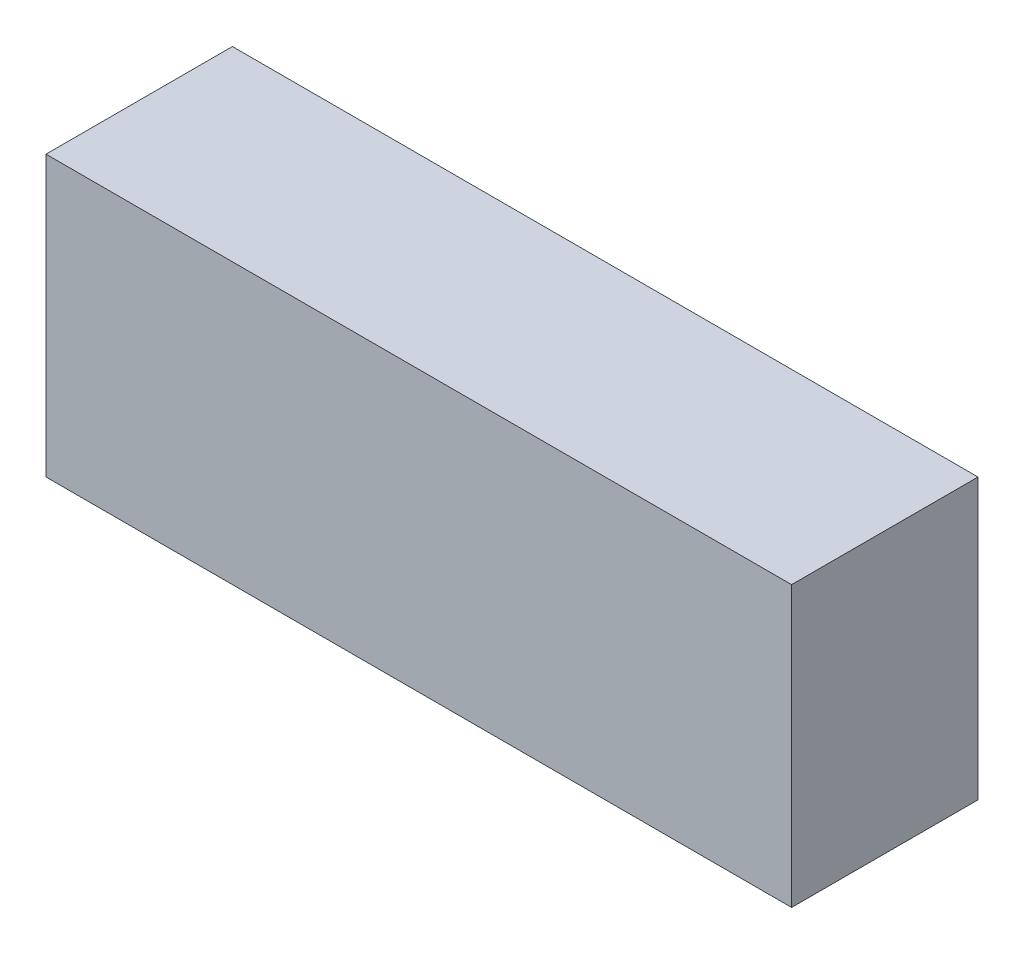
from build123d import *

# Parameters (mm, degrees)
SKETCH1_W           = 80
SKETCH1_H           = 20
BOSS_EXTRUDE1_DEPTH = 30


with BuildPart() as part:
    # Sketch1 → Boss-Extrude1 (new body)
    with BuildSketch(Plane(origin=(0, 0, 0), x_dir=(1, 0, 0), z_dir=(0, 1, 0))):
        Rectangle(SKETCH1_W, SKETCH1_H)
    extrude(amount=BOSS_EXTRUDE1_DEPTH)


solid = part.part
